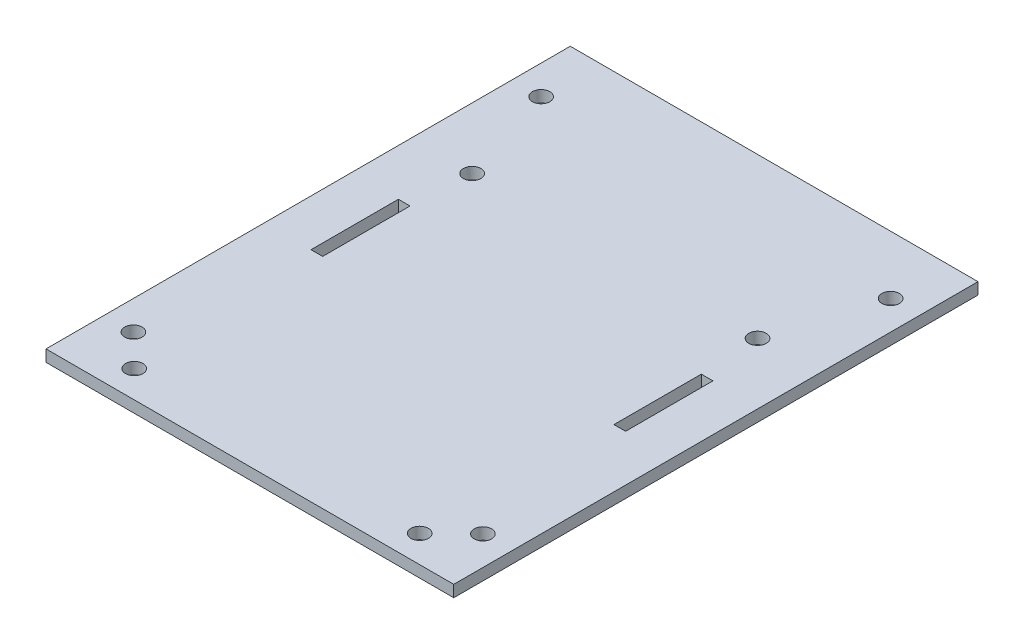
from build123d import *

# Parameters (mm, degrees)
SKETCH_1_W      = 70
SKETCH_1_H      = 90
SKETCH_1_R      = 1.5
SKETCH_1_W_2    = 2
SKETCH_1_H_2    = 15
EXTRUDE_1_DEPTH = 2


with BuildPart() as part:
    # 草圖1 → 填料-伸長1 (new body)
    with BuildSketch(Plane(origin=(0, 0, 0), x_dir=(1, 0, 0), z_dir=(0, 1, 0))):
        Rectangle(SKETCH_1_W, SKETCH_1_H)
        with Locations((-30, 35)):
            Circle(SKETCH_1_R, mode=Mode.SUBTRACT)
        with Locations((30, 35)):
            Circle(SKETCH_1_R, mode=Mode.SUBTRACT)
        with Locations((30, -35)):
            Circle(SKETCH_1_R, mode=Mode.SUBTRACT)
        with Locations((-30, -35)):
            Circle(SKETCH_1_R, mode=Mode.SUBTRACT)
        with Locations((24.5, 17.65)):
            Circle(SKETCH_1_R, mode=Mode.SUBTRACT)
        with Locations((24.5, -40.35)):
            Circle(SKETCH_1_R, mode=Mode.SUBTRACT)
        with Locations((-24.5, 17.65)):
            Circle(SKETCH_1_R, mode=Mode.SUBTRACT)
        with Locations((-24.5, -40.35)):
            Circle(SKETCH_1_R, mode=Mode.SUBTRACT)
        with Locations((-26, 0)):
            Rectangle(SKETCH_1_W_2, SKETCH_1_H_2, mode=Mode.SUBTRACT)
        with Locations((26, 0)):
            Rectangle(SKETCH_1_W_2, SKETCH_1_H_2, mode=Mode.SUBTRACT)
    extrude(amount=EXTRUDE_1_DEPTH)


solid = part.part
